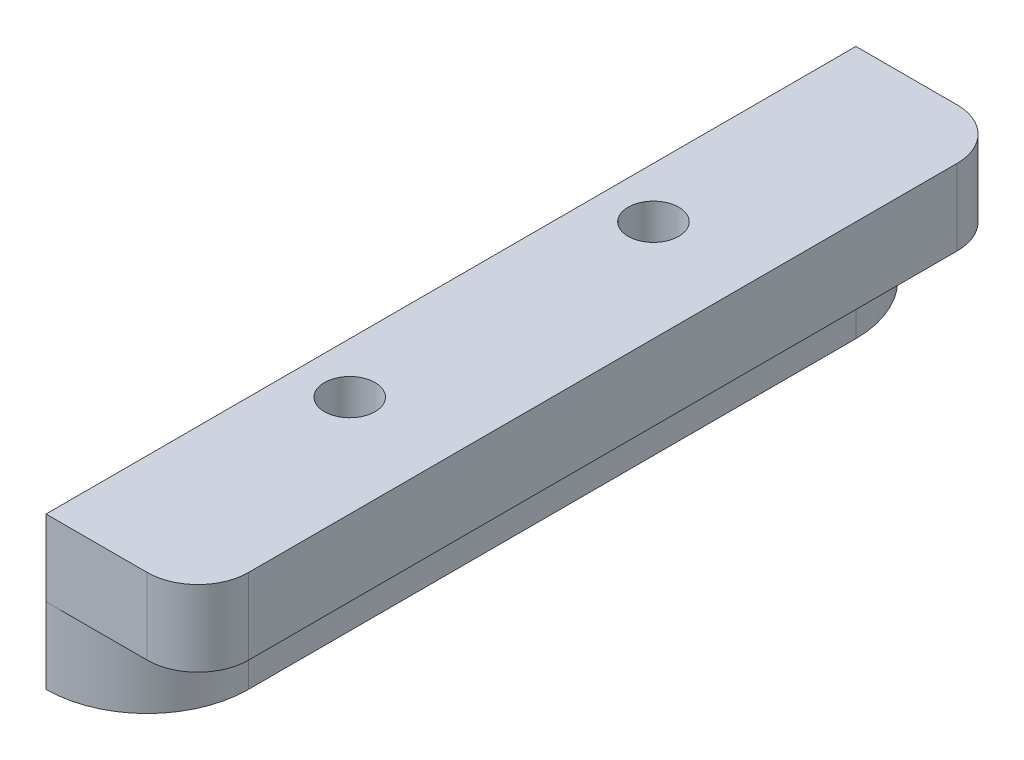
from build123d import *

# Parameters (mm, degrees)
SKETCH1_W                       = 19.05
SKETCH1_H                       = 101.6
BOSS_EXTRUDE1_DEPTH             = 9.525
SKETCH2_W                       = 6.35
SKETCH2_H                       = 9.525
CUT_EXTRUDE1_DEPTH              = 103.489078686
F_1_4_0_25_DIAMETER_HOLE1_D     = 6.35
F_1_4_0_25_DIAMETER_HOLE1_DEPTH = 25.4
F_1_4_0_25_DIAMETER_HOLE1_TIP   = 1.907732465
FILLET1_R                       = 12.7
FILLET2_R                       = 6.35


with BuildPart() as part:
    # Sketch1 → Boss-Extrude1 (new, symmetric)
    with BuildSketch(Plane(origin=(0, 0, 0), x_dir=(1, 0, 0), z_dir=(0, 1, 0))):
        Rectangle(SKETCH1_W, SKETCH1_H)
    extrude(amount=BOSS_EXTRUDE1_DEPTH, both=True)

    # Sketch2 → Cut-Extrude1 (cut, through all)
    with BuildSketch(Plane.XY.offset(50.8)):
        with Locations((6.35, -4.7625)):
            Rectangle(SKETCH2_W, SKETCH2_H)
    extrude(amount=-CUT_EXTRUDE1_DEPTH, mode=Mode.SUBTRACT)

    # 1/4 (0.25) Diameter Hole1
    with Locations(Plane(origin=(0, 9.525, 0), x_dir=(1, 0, 0), z_dir=(0, 1, 0))):
        with Locations((-3.175, 19.05), (-3.175, -19.05)):
            Hole(F_1_4_0_25_DIAMETER_HOLE1_D / 2, depth=F_1_4_0_25_DIAMETER_HOLE1_DEPTH)
            with Locations((0, 0, -(F_1_4_0_25_DIAMETER_HOLE1_DEPTH + F_1_4_0_25_DIAMETER_HOLE1_TIP / 2))):  # 118° drill point
                Cone(0, F_1_4_0_25_DIAMETER_HOLE1_D / 2, F_1_4_0_25_DIAMETER_HOLE1_TIP, mode=Mode.SUBTRACT)

    # Fillet1
    fillet1_edges = [part.edges().sort_by_distance(p)[0] for p in [
        (3.175, -4.7625, -50.8),
        (3.175, -4.7625, 50.8),
    ]]
    fillet(fillet1_edges, radius=FILLET1_R - 0.0001)  # a hair under: the kernel refuses the full size

    # Fillet2
    fillet2_edges = [part.edges().sort_by_distance(p)[0] for p in [
        (9.525, 4.7625, -50.8),
        (9.525, 4.7625, 50.8),
    ]]
    fillet(fillet2_edges, radius=FILLET2_R)


solid = part.part
